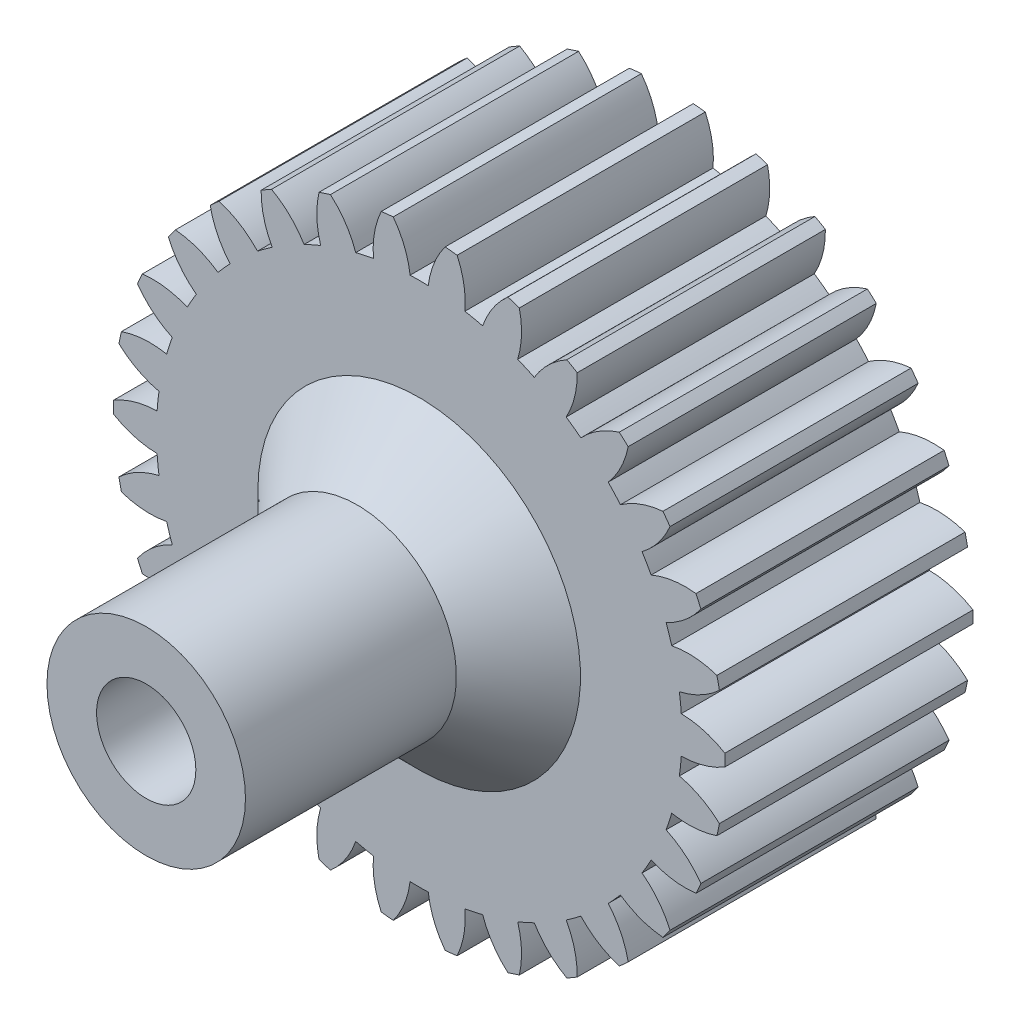
from build123d import *
from build123d.topology import SkipClean

# Parameters (mm, degrees)
SKETCH_1_R               = 12.32
EXTRUDE_1_DEPTH          = 5
PATTERN_CIRCULAR_1_COUNT = 30
SKETCH_6_R               = 4
EXTRUDE_2_DEPTH          = 11
SKETCH_7_R               = 2
CUT_EXTRUDE_1_DEPTH      = 3
CUT_EXTRUDE_2_DEPTH      = 26.029377093
CUT_EXTRUDE_2_DEPTH_BACK = 7


with BuildPart() as part:
    # Эскиз1 → Бобышка-Вытянуть1 (new, symmetric)
    with BuildSketch(Plane.XY):
        Circle(SKETCH_1_R)
    extrude(amount=EXTRUDE_1_DEPTH, both=True)

    # Эскиз5 for Вырез-По сечениям1 → Вырез-По сечениям1 section 0
    with BuildSketch(Plane.XY.offset(-5)):
        with BuildLine():
            # circular arc as an exact rational Bezier (weights 1, cos(half-angle), 1)
            Bezier((-1.458691761, 12.736742847), (-0.522105639, 11.856767026), (-0.365824723, 10.581178031), weights=[1, 0.940287899, 1])
            Bezier((-0.365824723, 10.581178031), (0, 10.593825746), (0.365824723, 10.581178031), weights=[1, 0.999402884, 1])
            Bezier((0.365824723, 10.581178031), (0.522105639, 11.856767026), (1.458691761, 12.736742847), weights=[1, 0.940287899, 1])
            Bezier((1.458691761, 12.736742847), (0, 12.903801386), (-1.458691761, 12.736742847), weights=[1, 0.993505682, 1])
        make_face()
    # Эскиз2 for Вырез-По сечениям1 → Вырез-По сечениям1 section 1
    with BuildSketch(Plane.XY.offset(5)):
        with BuildLine():
            Bezier((-1.458691761, 12.736742847), (-0.522105639, 11.856767026), (-0.365824723, 10.581178031), weights=[1, 0.940287899, 1])
            Bezier((-0.365824723, 10.581178031), (0, 10.593825746), (0.365824723, 10.581178031), weights=[1, 0.999402884, 1])
            Bezier((0.365824723, 10.581178031), (0.522105639, 11.856767026), (1.458691761, 12.736742847), weights=[1, 0.940287899, 1])
            Bezier((1.458691761, 12.736742847), (0, 12.903801386), (-1.458691761, 12.736742847), weights=[1, 0.993505682, 1])
        make_face()
    loft_1 = loft(mode=Mode.SUBTRACT)

    # Круговой массив1: Вырез-По сечениям1 ×30 about axis
    pattern_circular_1_axis = Axis((0, 0, 5), (0, 0, -1))
    for i in range(1, PATTERN_CIRCULAR_1_COUNT):
        add(loft_1.rotate(pattern_circular_1_axis, i * 360 / PATTERN_CIRCULAR_1_COUNT), mode=Mode.SUBTRACT)

    # Эскиз6 → Бобышка-Вытянуть2 (add)
    with BuildSketch(Plane.XY.offset(5)):
        Circle(SKETCH_6_R)
    extrude(amount=EXTRUDE_2_DEPTH)

    # Эскиз7 → Вырез-Вытянуть1 (cut)
    with BuildSketch(Plane.XY.offset(16)):
        Circle(SKETCH_7_R)
    extrude(amount=-CUT_EXTRUDE_1_DEPTH, mode=Mode.SUBTRACT)

    # Эскиз8 → Вырез-Вытянуть2 (cut, two sides: drawn at the far end of the back side and taken through both)
    with SkipClean():  # the faces are left unmerged after this step: merging them gives an invalid solid
        with BuildSketch(Plane.XY.offset(13).offset(-CUT_EXTRUDE_2_DEPTH_BACK)):
            with BuildLine():
                Line((1.263922466, 1.55), (-1.263922466, 1.55))
                ThreePointArc((-1.263922466, 1.55), (-0.85794961, -1.806632908), (2, 0))
                ThreePointArc((2, 0), (1.806632908, 0.85794961), (1.263922466, 1.55))
            make_face()
        extrude(amount=CUT_EXTRUDE_2_DEPTH + CUT_EXTRUDE_2_DEPTH_BACK, mode=Mode.SUBTRACT)

    # Эскиз10 → Повернуть1 (revolve)
    with SkipClean():  # the faces are left unmerged after this step: merging them gives an invalid solid
        with BuildSketch(Plane(origin=(0, 0, 0), x_dir=(1, 0, 0), z_dir=(0, 1, 0))):
            Polygon((4, -7.5), (6.5, -5), (4, -5), align=None)
        revolve(axis=Axis((0, 0, -5.894370347), (0, 0, 1)))


solid = part.part
